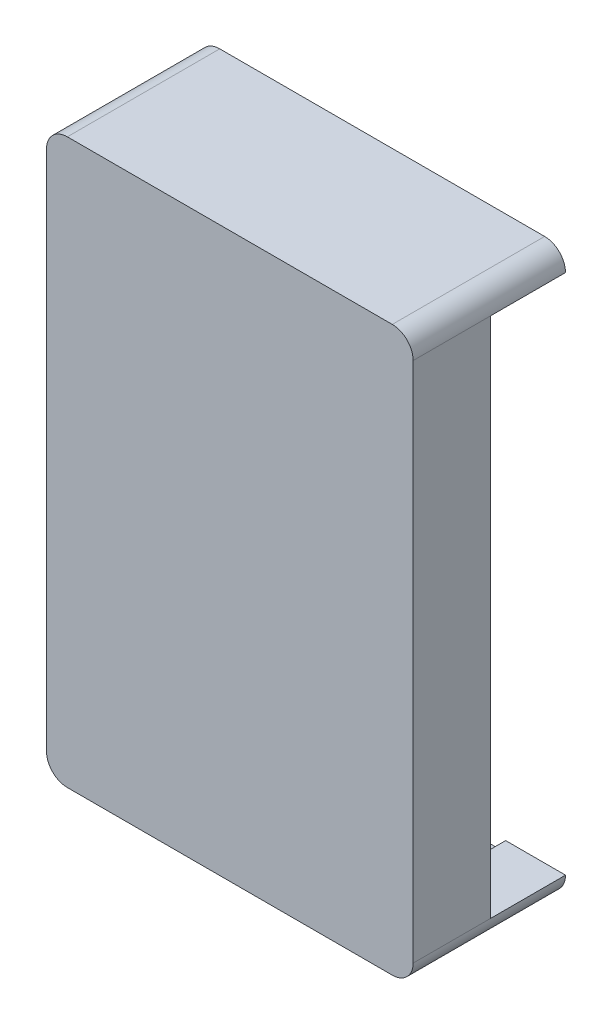
from build123d import *

# Parameters (mm, degrees)
BOSS_EXTRUDE1_DEPTH  = 75
BOSS_EXTRUDE2_START  = -3
SKETCH1_3_R          = 10.75
BOSS_EXTRUDE2_DEPTH  = 3
CUT_EXTRUDE1_DEPTH   = 16.75
MIRROR3_COPY_1_DEPTH = 16.75
SKETCH5_W            = 15.25
SKETCH5_H            = 1.1
CUT_EXTRUDE2_DEPTH   = 2
FILLET1_R            = 3


with BuildPart() as part:
    # Sketch1 → Boss-Extrude1 (new body)
    with BuildSketch(Plane(origin=(0, 0, 0), x_dir=(1, 0, 0), z_dir=(0, 1, 0))):
        with BuildLine():
            Line((0, 0), (12.6, 0))
            Line((12.6, 0), (12.6, 0.4))
            ThreePointArc((12.6, 0.4), (4.998602102, 3.548602102), (1.85, 11.15))
            Line((1.85, 11.15), (0, 11.15))
            Line((0, 11.15), (0, 0))
        make_face()
        with BuildLine():
            Line((12.6, 0), (26.35, 0))
            Line((26.35, 0), (26.35, 11.15))
            Line((26.35, 11.15), (23.35, 11.15))
            ThreePointArc((23.35, 11.15), (20.201397898, 3.548602102), (12.6, 0.4))
            Line((12.6, 0.4), (12.6, 0))
        make_face()
        with BuildLine():
            Line((26.35, 11.15), (26.35, 0))
            Line((26.35, 0), (52.7, 0))
            Line((52.7, 0), (52.7, 11.15))
            Line((52.7, 11.15), (50.85, 11.15))
            ThreePointArc((50.85, 11.15), (40.1, 0.4), (29.35, 11.15))
            Line((29.35, 11.15), (26.35, 11.15))
        make_face()
    extrude(amount=BOSS_EXTRUDE1_DEPTH)

    # Sketch1<3> → Boss-Extrude2 (add)
    with BuildSketch(Plane(origin=(0, 0, 0), x_dir=(1, 0, 0), z_dir=(0, 1, 0)).offset(BOSS_EXTRUDE2_START)):
        with BuildLine():
            Line((50.85, 11.15), (52.7, 11.15))
            Line((52.7, 11.15), (52.7, 21.9))
            Line((52.7, 21.9), (40.1, 21.9))
            ThreePointArc((40.1, 21.9), (47.701397898, 18.751397898), (50.85, 11.15))
        make_face()
        with BuildLine():
            Line((26.35, 11.15), (26.35, 0))
            Line((26.35, 0), (52.7, 0))
            Line((52.7, 0), (52.7, 11.15))
            Line((52.7, 11.15), (50.85, 11.15))
            ThreePointArc((50.85, 11.15), (40.1, 0.4), (29.35, 11.15))
            Line((29.35, 11.15), (26.35, 11.15))
        make_face()
        with Locations((40.1, 11.15)):
            Circle(SKETCH1_3_R)
        with BuildLine():
            Line((23.35, 11.15), (26.35, 11.15))
            Line((26.35, 11.15), (29.35, 11.15))
            ThreePointArc((29.35, 11.15), (32.498602102, 18.751397898), (40.1, 21.9))
            Line((40.1, 21.9), (12.6, 21.9))
            ThreePointArc((12.6, 21.9), (20.201397898, 18.751397898), (23.35, 11.15))
        make_face()
        with BuildLine():
            Line((12.6, 0), (26.35, 0))
            Line((26.35, 0), (26.35, 11.15))
            Line((26.35, 11.15), (23.35, 11.15))
            ThreePointArc((23.35, 11.15), (20.201397898, 3.548602102), (12.6, 0.4))
            Line((12.6, 0.4), (12.6, 0))
        make_face()
        with Locations((12.6, 11.15)):
            Circle(SKETCH1_3_R)
        with BuildLine():
            Line((0, 0), (12.6, 0))
            Line((12.6, 0), (12.6, 0.4))
            ThreePointArc((12.6, 0.4), (4.998602102, 3.548602102), (1.85, 11.15))
            Line((1.85, 11.15), (0, 11.15))
            Line((0, 11.15), (0, 0))
        make_face()
        with BuildLine():
            ThreePointArc((1.85, 11.15), (4.998602102, 18.751397898), (12.6, 21.9))
            Line((12.6, 21.9), (0, 21.9))
            Line((0, 21.9), (0, 11.15))
            Line((0, 11.15), (1.85, 11.15))
        make_face()
    boss_extrude2 = extrude(amount=BOSS_EXTRUDE2_DEPTH)

    # Sketch4 → Cut-Extrude1 (cut)
    with BuildSketch(Plane(origin=(0, 0, -21.9), x_dir=(-1, 0, 0), z_dir=(0, 0, -1))):
        Polygon((-18.725, -1.5), (-6.475, -1.5), (-6.475, -0.4), (-8.6, -0.4), (-8.6, 0), (-16.6, 0), (-16.6, -0.4), (-18.725, -0.4), align=None)
    cut_extrude1 = extrude(amount=-CUT_EXTRUDE1_DEPTH, mode=Mode.SUBTRACT)

    # Mirror2: Cut-Extrude1 across plane
    add(cut_extrude1.mirror(Plane(origin=(26.35, 0, 0), x_dir=(0, 0, 1), z_dir=(1, 0, 0))), mode=Mode.SUBTRACT)

    # Mirror3: Boss-Extrude2, Cut-Extrude1 across plane
    add(boss_extrude2.mirror(Plane.ZX.offset(37.5)))
    add(cut_extrude1.mirror(Plane.ZX.offset(37.5)), mode=Mode.SUBTRACT)

    # Mirror3 copy 1 sketch → Mirror3 copy 1 (cut)
    with BuildSketch(Plane(origin=(52.7, 75, -21.9), x_dir=(1, 0, 0), z_dir=(0, 0, -1))):
        Polygon((-18.725, -1.5), (-6.475, -1.5), (-6.475, -0.4), (-8.6, -0.4), (-8.6, 0), (-16.6, 0), (-16.6, -0.4), (-18.725, -0.4), align=None)
    extrude(amount=-MIRROR3_COPY_1_DEPTH, mode=Mode.SUBTRACT)

    # Sketch5 → Cut-Extrude2 (cut)
    with BuildSketch(Plane(origin=(0, 0, -21.9), x_dir=(-1, 0, 0), z_dir=(0, 0, -1))):
        with Locations((-26.35, 75.95)):
            Rectangle(SKETCH5_W, SKETCH5_H)
    extrude(amount=-CUT_EXTRUDE2_DEPTH, mode=Mode.SUBTRACT)

    # Fillet1
    fillet1_edges = [part.edges().sort_by_distance(p)[0] for p in [
        (0, 78, -10.95),
        (52.7, 78, -10.95),
        (52.7, -3, -10.95),
        (0, -3, -10.95),
    ]]
    fillet(fillet1_edges, radius=FILLET1_R - 0.0001)  # a hair under: the kernel refuses the full size


solid = part.part
